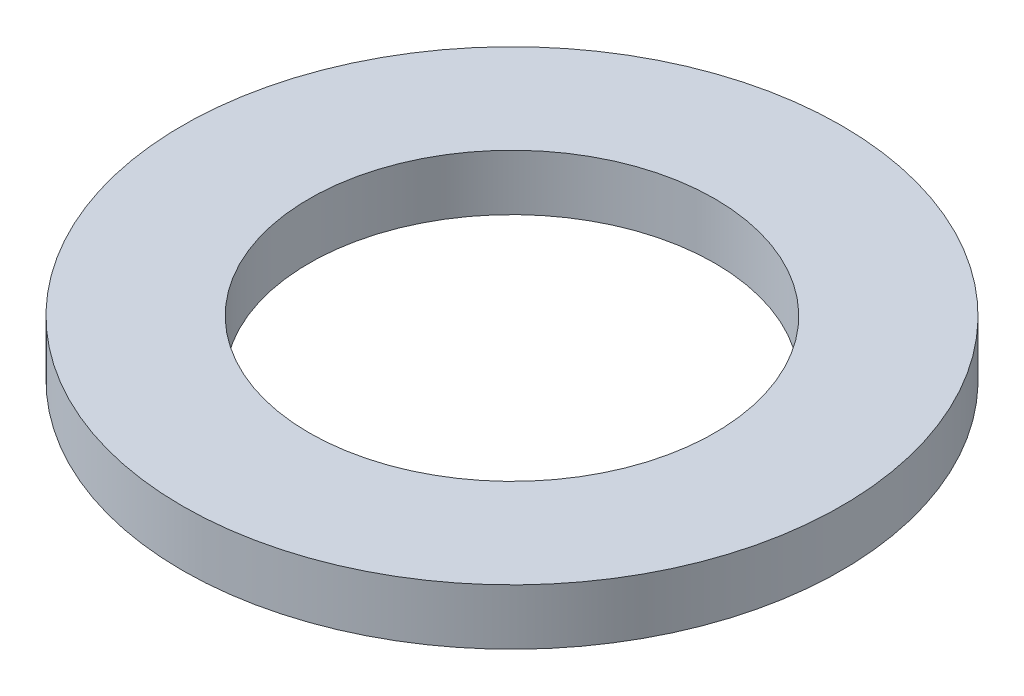
from build123d import *

# Parameters (mm, degrees)
SKETCH1_R           = 65
BOSS_EXTRUDE1_DEPTH = 11
SKETCH2_R           = 40
CUT_EXTRUDE1_DEPTH  = 93.579695398


with BuildPart() as part:
    # Sketch1 → Boss-Extrude1 (new body)
    with BuildSketch(Plane(origin=(0, 0, 0), x_dir=(1, 0, 0), z_dir=(0, 1, 0))):
        Circle(SKETCH1_R)
    extrude(amount=BOSS_EXTRUDE1_DEPTH)

    # Sketch2 → Cut-Extrude1 (cut, through all)
    with BuildSketch(Plane(origin=(0, 0, 0), x_dir=(1, 0, 0), z_dir=(0, 1, 0))):
        Circle(SKETCH2_R)
    extrude(amount=CUT_EXTRUDE1_DEPTH, mode=Mode.SUBTRACT)


solid = part.part
